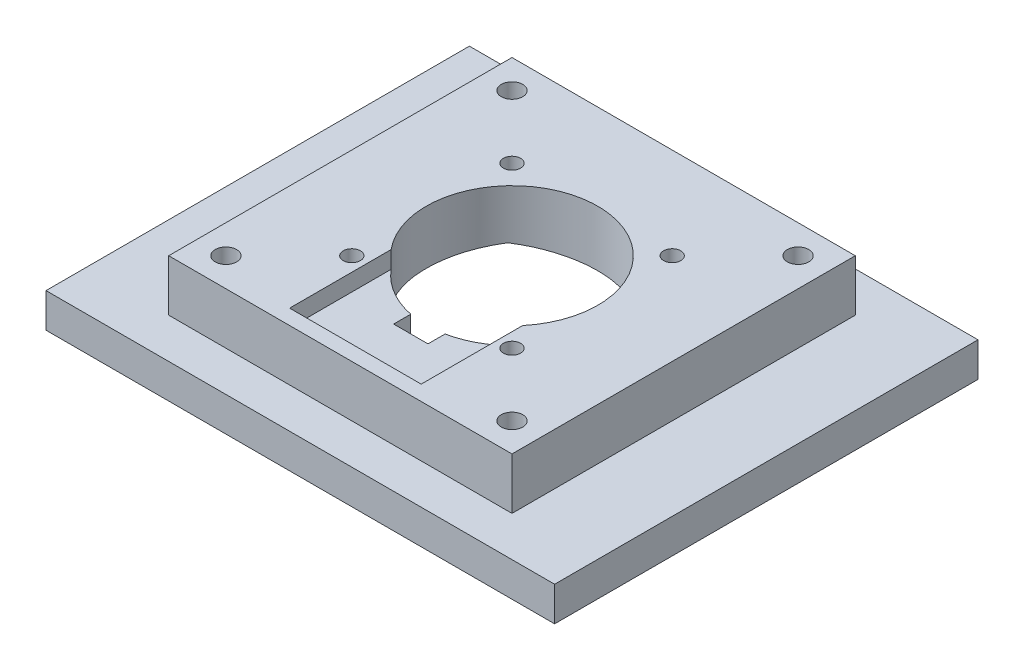
from build123d import *

# Parameters (mm, degrees)
SKETCH1_W           = 60
SKETCH1_H           = 60
BOSS_EXTRUDE1_DEPTH = 15
SKETCH10_W          = 15
SKETCH10_H          = 15
CUT_EXTRUDE4_DEPTH  = 8
SKETCH9_W           = 88.892246252
SKETCH9_H           = 74
SKETCH9_W_2         = 60
SKETCH9_H_2         = 60
BOSS_EXTRUDE4_DEPTH = 6
SKETCH2_R           = 15
CUT_EXTRUDE5_DEPTH  = 60.744940206
SKETCH11_R          = 1.5
CUT_EXTRUDE6_DEPTH  = 6
SKETCH12_W          = 23
SKETCH12_H          = 10.738639716
CUT_EXTRUDE7_DEPTH  = 3
SKETCH13_W          = 23
SKETCH13_H          = 7
CUT_EXTRUDE8_DEPTH  = 3
SKETCH14_R          = 1.875
CUT_EXTRUDE9_DEPTH  = 5
SKETCH15_W          = 6
SKETCH15_H          = 8
CUT_EXTRUDE10_DEPTH = 60.063168554


with BuildPart() as part:
    # Sketch1 → Boss-Extrude1 (new body)
    with BuildSketch(Plane(origin=(0, 0, 0), x_dir=(1, 0, 0), z_dir=(0, 1, 0))):
        Rectangle(SKETCH1_W, SKETCH1_H)
    extrude(amount=BOSS_EXTRUDE1_DEPTH)

    # Sketch10 → Cut-Extrude4 (cut)
    with BuildSketch(Plane(origin=(0, 15, 0), x_dir=(1, 0, 0), z_dir=(0, 1, 0))):
        Rectangle(SKETCH10_W, SKETCH10_H)
    extrude(amount=-CUT_EXTRUDE4_DEPTH, mode=Mode.SUBTRACT)

    # Sketch9 → Boss-Extrude4 (add)
    with BuildSketch(Plane.XZ):
        Rectangle(SKETCH9_W, SKETCH9_H)
        Rectangle(SKETCH9_W_2, SKETCH9_H_2, mode=Mode.SUBTRACT)
    extrude(amount=-BOSS_EXTRUDE4_DEPTH)

    # Cut-Loft2: read off the stored shape, not the designer's step
    # Cut-Loft2: loft between two sections, ruled curve by curve
    cut_loft2_from = [
        Edge.make_line((-7.5, 7, -7.5), (7.5, 7, -7.5)),
        Edge.make_line((7.5, 7, -7.5), (7.5, 7, 7.5)),
        Edge.make_line((-7.5, 7, 7.5), (-7.5, 7, -7.5)),
        Edge.make_line((7.5, 7, 7.5), (-7.5, 7, 7.5)),
    ]
    cut_loft2_to = [
        Edge.make_line((-44.446123126, 0, -37), (44.446123126, 0, -37)),
        Edge.make_line((44.446123126, 0, -37), (44.446123126, 0, 37)),
        Edge.make_line((-44.446123126, 0, 37), (-44.446123126, 0, -37)),
        Edge.make_line((44.446123126, 0, 37), (-44.446123126, 0, 37)),
    ]
    cut_loft2 = Solid(Shell([*[Face.make_surface_from_curves(cut_loft2_from[k], cut_loft2_to[k]) for k in range(4)], Face(Wire(cut_loft2_from)), Face(Wire(cut_loft2_to))]))
    add(cut_loft2, mode=Mode.SUBTRACT)

    # Sketch2 → Cut-Extrude5 (cut, through all)
    with BuildSketch(Plane(origin=(0, 15, 0), x_dir=(1, 0, 0), z_dir=(0, 1, 0))):
        with Locations(Location((0, 0, 0), (0, 0, 270))):
            Circle(SKETCH2_R)
    extrude(amount=-CUT_EXTRUDE5_DEPTH, mode=Mode.SUBTRACT)

    # Sketch11 → Cut-Extrude6 (cut)
    with BuildSketch(Plane(origin=(0, 15, 0), x_dir=(1, 0, 0), z_dir=(0, 1, 0))):
        with Locations(Location((-14, 14, 0), (0, 0, 270))):
            Circle(SKETCH11_R)
        with Locations(Location((14, 14, 0), (0, 0, 270))):
            Circle(SKETCH11_R)
        with Locations(Location((14, -14, 0), (0, 0, 270))):
            Circle(SKETCH11_R)
        with Locations(Location((-14, -14, 0), (0, 0, 270))):
            Circle(SKETCH11_R)
    extrude(amount=-CUT_EXTRUDE6_DEPTH, mode=Mode.SUBTRACT)

    # Sketch12 → Cut-Extrude7 (cut)
    with BuildSketch(Plane(origin=(0, 15, 0), x_dir=(1, 0, 0), z_dir=(0, 1, 0))):
        with Locations((0, -15)):
            Rectangle(SKETCH12_W, SKETCH12_H)
    extrude(amount=-CUT_EXTRUDE7_DEPTH, mode=Mode.SUBTRACT)

    # Sketch13 → Cut-Extrude8 (cut)
    with BuildSketch(Plane(origin=(0, 15, 0), x_dir=(1, 0, 0), z_dir=(0, 1, 0))):
        with Locations((0, -23.869319858)):
            Rectangle(SKETCH13_W, SKETCH13_H)
    extrude(amount=-CUT_EXTRUDE8_DEPTH, mode=Mode.SUBTRACT)

    # Sketch14 → Cut-Extrude9 (cut)
    with BuildSketch(Plane(origin=(0, 15, 0), x_dir=(1, 0, 0), z_dir=(0, 1, 0))):
        with Locations(Location((-25, 25, 0), (0, 0, 270))):
            Circle(SKETCH14_R)
        with Locations(Location((25, 25, 0), (0, 0, 270))):
            Circle(SKETCH14_R)
        with Locations(Location((25, -25, 0), (0, 0, 270))):
            Circle(SKETCH14_R)
        with Locations(Location((-25, -25, 0), (0, 0, 270))):
            Circle(SKETCH14_R)
    extrude(amount=-CUT_EXTRUDE9_DEPTH, mode=Mode.SUBTRACT)

    # Sketch15 → Cut-Extrude10 (cut, through all)
    with BuildSketch(Plane(origin=(0, 12, 0), x_dir=(1, 0, 0), z_dir=(0, 1, 0))):
        with Locations((0, -13.684659929)):
            Rectangle(SKETCH15_W, SKETCH15_H)
    extrude(amount=-CUT_EXTRUDE10_DEPTH, mode=Mode.SUBTRACT)


solid = part.part
